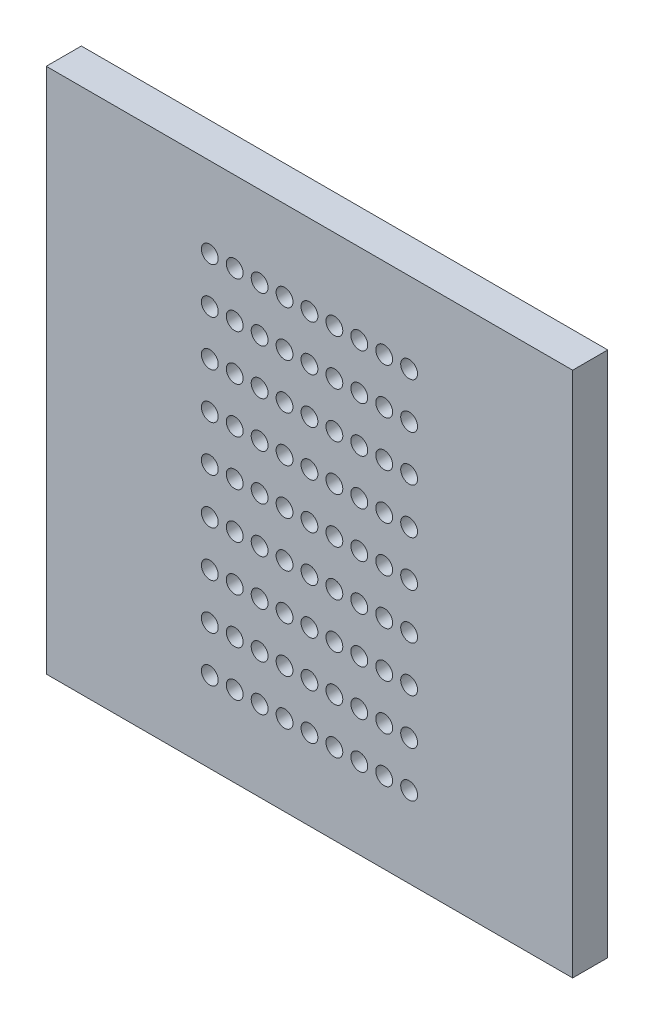
from build123d import *

# Parameters (mm, degrees)
ESQUISSE2_W             = 30
ESQUISSE2_H             = 30
BOSS_EXTRU_1_DEPTH      = 2
ESQUISSE3_R             = 0.48
ENL_V_MAT_EXTRU_1_DEPTH = 10


with BuildPart() as part:
    # Esquisse2 → Boss.-Extru.1 (new body)
    with BuildSketch(Plane.XY):
        Rectangle(ESQUISSE2_W, ESQUISSE2_H)
    extrude(amount=BOSS_EXTRU_1_DEPTH)

    # Esquisse3 → Enlèv. mat.-Extru.1 (cut)
    with BuildSketch(Plane.XY.offset(2)):
        with Locations((-5.68, -10.4)):
            Circle(ESQUISSE3_R)
        with Locations((-5.68, -7.8)):
            Circle(ESQUISSE3_R)
        with Locations((-5.68, -5.2)):
            Circle(ESQUISSE3_R)
        with Locations((-5.68, -2.6)):
            Circle(ESQUISSE3_R)
        with Locations((-5.68, 0)):
            Circle(ESQUISSE3_R)
        with Locations((-5.68, 2.6)):
            Circle(ESQUISSE3_R)
        with Locations((-5.68, 5.2)):
            Circle(ESQUISSE3_R)
        with Locations((-5.68, 7.8)):
            Circle(ESQUISSE3_R)
        with Locations((-5.68, 10.4)):
            Circle(ESQUISSE3_R)
        with Locations((-4.26, -10.4)):
            Circle(ESQUISSE3_R)
        with Locations((-4.26, -7.8)):
            Circle(ESQUISSE3_R)
        with Locations((-4.26, -5.2)):
            Circle(ESQUISSE3_R)
        with Locations((-4.26, -2.6)):
            Circle(ESQUISSE3_R)
        with Locations((-4.26, 0)):
            Circle(ESQUISSE3_R)
        with Locations((-4.26, 2.6)):
            Circle(ESQUISSE3_R)
        with Locations((-4.26, 5.2)):
            Circle(ESQUISSE3_R)
        with Locations((-4.26, 7.8)):
            Circle(ESQUISSE3_R)
        with Locations((-4.26, 10.4)):
            Circle(ESQUISSE3_R)
        with Locations((-2.84, -10.4)):
            Circle(ESQUISSE3_R)
        with Locations((-2.84, -7.8)):
            Circle(ESQUISSE3_R)
        with Locations((-2.84, -5.2)):
            Circle(ESQUISSE3_R)
        with Locations((-2.84, -2.6)):
            Circle(ESQUISSE3_R)
        with Locations((-2.84, 0)):
            Circle(ESQUISSE3_R)
        with Locations((-2.84, 2.6)):
            Circle(ESQUISSE3_R)
        with Locations((-2.84, 5.2)):
            Circle(ESQUISSE3_R)
        with Locations((-2.84, 7.8)):
            Circle(ESQUISSE3_R)
        with Locations((-2.84, 10.4)):
            Circle(ESQUISSE3_R)
        with Locations((-1.42, -10.4)):
            Circle(ESQUISSE3_R)
        with Locations((-1.42, -7.8)):
            Circle(ESQUISSE3_R)
        with Locations((-1.42, -5.2)):
            Circle(ESQUISSE3_R)
        with Locations((-1.42, -2.6)):
            Circle(ESQUISSE3_R)
        with Locations((-1.42, 0)):
            Circle(ESQUISSE3_R)
        with Locations((-1.42, 2.6)):
            Circle(ESQUISSE3_R)
        with Locations((-1.42, 5.2)):
            Circle(ESQUISSE3_R)
        with Locations((-1.42, 7.8)):
            Circle(ESQUISSE3_R)
        with Locations((-1.42, 10.4)):
            Circle(ESQUISSE3_R)
        with Locations((0, -10.4)):
            Circle(ESQUISSE3_R)
        with Locations((0, -7.8)):
            Circle(ESQUISSE3_R)
        with Locations((0, -5.2)):
            Circle(ESQUISSE3_R)
        with Locations((0, -2.6)):
            Circle(ESQUISSE3_R)
        Circle(ESQUISSE3_R)
        with Locations((0, 2.6)):
            Circle(ESQUISSE3_R)
        with Locations((0, 5.2)):
            Circle(ESQUISSE3_R)
        with Locations((0, 7.8)):
            Circle(ESQUISSE3_R)
        with Locations((0, 10.4)):
            Circle(ESQUISSE3_R)
        with Locations((1.42, -10.4)):
            Circle(ESQUISSE3_R)
        with Locations((1.42, -7.8)):
            Circle(ESQUISSE3_R)
        with Locations((1.42, -5.2)):
            Circle(ESQUISSE3_R)
        with Locations((1.42, -2.6)):
            Circle(ESQUISSE3_R)
        with Locations((1.42, 0)):
            Circle(ESQUISSE3_R)
        with Locations((1.42, 2.6)):
            Circle(ESQUISSE3_R)
        with Locations((1.42, 5.2)):
            Circle(ESQUISSE3_R)
        with Locations((1.42, 7.8)):
            Circle(ESQUISSE3_R)
        with Locations((1.42, 10.4)):
            Circle(ESQUISSE3_R)
        with Locations((2.84, -10.4)):
            Circle(ESQUISSE3_R)
        with Locations((2.84, -7.8)):
            Circle(ESQUISSE3_R)
        with Locations((2.84, -5.2)):
            Circle(ESQUISSE3_R)
        with Locations((2.84, -2.6)):
            Circle(ESQUISSE3_R)
        with Locations((2.84, 0)):
            Circle(ESQUISSE3_R)
        with Locations((2.84, 2.6)):
            Circle(ESQUISSE3_R)
        with Locations((2.84, 5.2)):
            Circle(ESQUISSE3_R)
        with Locations((2.84, 7.8)):
            Circle(ESQUISSE3_R)
        with Locations((2.84, 10.4)):
            Circle(ESQUISSE3_R)
        with Locations((4.26, -10.4)):
            Circle(ESQUISSE3_R)
        with Locations((4.26, -7.8)):
            Circle(ESQUISSE3_R)
        with Locations((4.26, -5.2)):
            Circle(ESQUISSE3_R)
        with Locations((4.26, -2.6)):
            Circle(ESQUISSE3_R)
        with Locations((4.26, 0)):
            Circle(ESQUISSE3_R)
        with Locations((4.26, 2.6)):
            Circle(ESQUISSE3_R)
        with Locations((4.26, 5.2)):
            Circle(ESQUISSE3_R)
        with Locations((4.26, 7.8)):
            Circle(ESQUISSE3_R)
        with Locations((4.26, 10.4)):
            Circle(ESQUISSE3_R)
        with Locations((5.68, -10.4)):
            Circle(ESQUISSE3_R)
        with Locations((5.68, -7.8)):
            Circle(ESQUISSE3_R)
        with Locations((5.68, -5.2)):
            Circle(ESQUISSE3_R)
        with Locations((5.68, -2.6)):
            Circle(ESQUISSE3_R)
        with Locations((5.68, 0)):
            Circle(ESQUISSE3_R)
        with Locations((5.68, 2.6)):
            Circle(ESQUISSE3_R)
        with Locations((5.68, 5.2)):
            Circle(ESQUISSE3_R)
        with Locations((5.68, 7.8)):
            Circle(ESQUISSE3_R)
        with Locations((5.68, 10.4)):
            Circle(ESQUISSE3_R)
    extrude(amount=-ENL_V_MAT_EXTRU_1_DEPTH, mode=Mode.SUBTRACT)


solid = part.part
